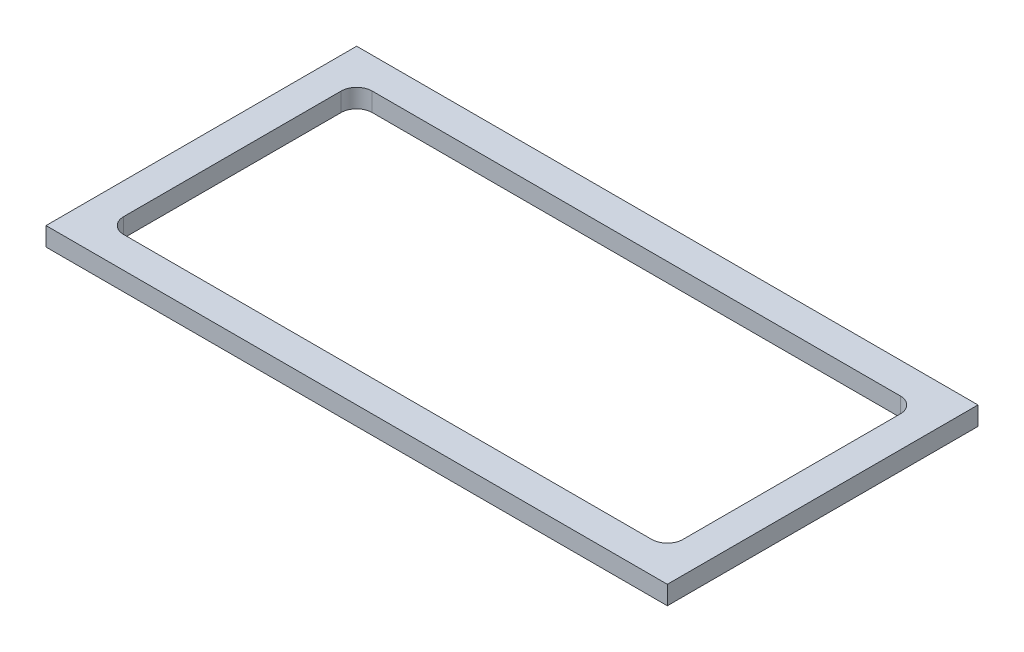
from build123d import *

# Parameters (mm, degrees)
SKETCH1_W           = 200
SKETCH1_H           = 100
BOSS_EXTRUDE1_DEPTH = 6
SKETCH2_W           = 180
SKETCH2_H           = 80
CUT_EXTRUDE1_DEPTH  = 224.687281713
FILLET1_R           = 5


with BuildPart() as part:
    # Sketch1 → Boss-Extrude1 (new body)
    with BuildSketch(Plane(origin=(0, 0, 0), x_dir=(1, 0, 0), z_dir=(0, 1, 0))):
        with Locations((100, 50)):
            Rectangle(SKETCH1_W, SKETCH1_H)
    extrude(amount=BOSS_EXTRUDE1_DEPTH)

    # Sketch2 → Cut-Extrude1 (cut, through all)
    with BuildSketch(Plane(origin=(0, 6, 0), x_dir=(1, 0, 0), z_dir=(0, 1, 0))):
        with Locations((100, 50)):
            Rectangle(SKETCH2_W, SKETCH2_H)
    extrude(amount=-CUT_EXTRUDE1_DEPTH, mode=Mode.SUBTRACT)

    # Fillet1
    fillet1_edges = [part.edges().sort_by_distance(p)[0] for p in [
        (10, 3, -10),
        (190, 3, -10),
        (190, 3, -90),
        (10, 3, -90),
    ]]
    fillet(fillet1_edges, radius=FILLET1_R)


solid = part.part
